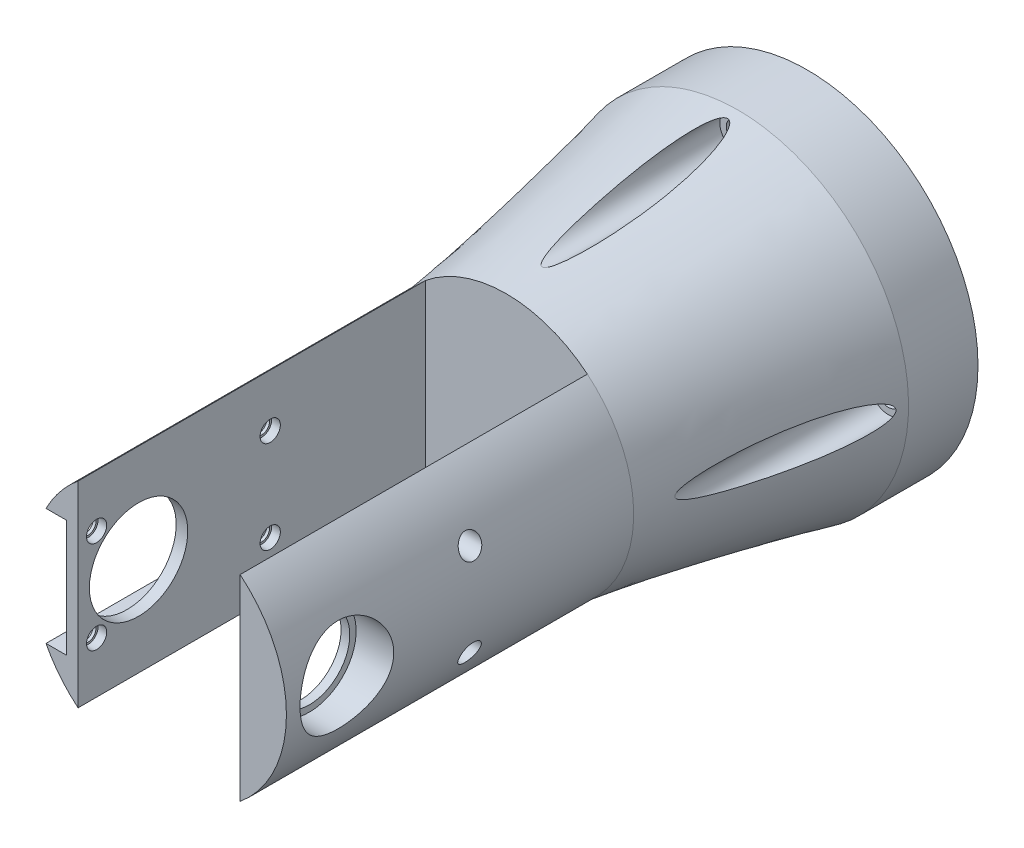
from build123d import *

# Parameters (mm, degrees)
SKETCH1_R           = 29.5
BOSS_EXTRUDE1_DEPTH = 12
SKETCH2_R           = 22
BOSS_EXTRUDE2_DEPTH = 100
SKETCH3_W           = 28
SKETCH3_H           = 50
CUT_EXTRUDE1_DEPTH  = 60
SKETCH11_R          = 2
CUT_EXTRUDE3_DEPTH  = 120.517781247
SKETCH12_R          = 3.1
CUT_EXTRUDE4_DEPTH  = 40
CUT_EXTRUDE7_START  = -35
CUT_EXTRUDE7_DEPTH  = 35
SKETCH14_R          = 8.5
CUT_EXTRUDE8_DEPTH  = 10
SKETCH15_R          = 1.4
CUT_EXTRUDE9_DEPTH  = 10
SKETCH16_R          = 8.1
CUT_EXTRUDE10_DEPTH = 10
SKETCH18_R          = 8.1
SKETCH18_R_2        = 7
BOSS_EXTRUDE3_DEPTH = 1.5
SKETCH19_R          = 1.75
CUT_EXTRUDE11_DEPTH = 1.5
SKETCH21_R          = 1.9
CUT_EXTRUDE13_DEPTH = 124.719440821


with BuildPart() as part:
    # Sketch1 → Boss-Extrude1 (new body)
    with BuildSketch(Plane.XY):
        Circle(SKETCH1_R)
    extrude(amount=BOSS_EXTRUDE1_DEPTH)

    # Sketch2 → Boss-Extrude2 (add)
    with BuildSketch(Plane.XY.offset(12)):
        Circle(SKETCH2_R)
    extrude(amount=BOSS_EXTRUDE2_DEPTH)

    # Sketch3 → Cut-Extrude1 (cut)
    with BuildSketch(Plane.XY.offset(112)):
        Rectangle(SKETCH3_W, SKETCH3_H)
    extrude(amount=-CUT_EXTRUDE1_DEPTH, mode=Mode.SUBTRACT)

    # Loft2: read off the stored shape, not the designer's step
    # Loft2: loft between two sections, ruled curve by curve
    loft2_from = [
        Edge.make_bspline([(6.119405658, -28.858324178, 12), (63.836054015, -16.619512862, 12), (51.597242698, 41.097135495, 12), (-6.119405658, 28.858324178, 12), (-63.836054015, 16.619512862, 12), (-51.597242698, -41.097135495, 12), (6.119405658, -28.858324178, 12)], [0, 0, 0, 0, 0.5, 0.5, 0.5, 1, 1, 1, 1], 3, [1, 0.333333333, 0.333333333, 1, 0.333333333, 0.333333333, 1]),
    ]
    loft2_to = [
        Edge.make_bspline([(-3.755202879, -21.677141217, 52), (39.599079554, -29.187546975, 52), (47.109485313, 14.166735458, 52), (3.755202879, 21.677141217, 52), (-39.599079554, 29.187546975, 52), (-47.109485313, -14.166735458, 52), (-3.755202879, -21.677141217, 52)], [0, 0, 0, 0, 0.5, 0.5, 0.5, 1, 1, 1, 1], 3, [1, 0.333333333, 0.333333333, 1, 0.333333333, 0.333333333, 1]),
    ]
    loft2 = Solid(Shell([*[Face.make_surface_from_curves(loft2_from[k], loft2_to[k]) for k in range(1)], Face(Wire(loft2_from)), Face(Wire(loft2_to))]))
    add(loft2)

    # Sketch11 → Cut-Extrude3 (cut, through all)
    with BuildSketch(Plane(origin=(0, 0, 0), x_dir=(-1, 0, 0), z_dir=(0, 0, -1))):
        with Locations((0, -26)):
            Circle(SKETCH11_R)
        with Locations((-26, 0)):
            Circle(SKETCH11_R)
        with Locations((0, 26)):
            Circle(SKETCH11_R)
        with Locations((26, 0)):
            Circle(SKETCH11_R)
    extrude(amount=-CUT_EXTRUDE3_DEPTH, mode=Mode.SUBTRACT)

    # Sketch12 → Cut-Extrude4 (cut)
    with BuildSketch(Plane.XY.offset(52)):
        with Locations((0, 26)):
            Circle(SKETCH12_R)
        with Locations((26, 0)):
            Circle(SKETCH12_R)
        with Locations((0, -26)):
            Circle(SKETCH12_R)
        with Locations((-26, 0)):
            Circle(SKETCH12_R)
    extrude(amount=-CUT_EXTRUDE4_DEPTH, mode=Mode.SUBTRACT)

    # Sketch13 → Cut-Extrude7 (cut)
    with BuildSketch(Plane.XY.offset(112).offset(CUT_EXTRUDE7_START)):
        with BuildLine():
            ThreePointArc((-19.544564462, -10.1), (-22, 0), (-19.544564462, 10.1))
            Line((-19.544564462, 10.1), (-16, 10.1))
            Line((-16, 10.1), (-16, -10.1))
            Line((-16, -10.1), (-19.544564462, -10.1))
        make_face()
    extrude(amount=CUT_EXTRUDE7_DEPTH, mode=Mode.SUBTRACT)

    # Sketch14 → Cut-Extrude8 (cut)
    with BuildSketch(Plane.ZY.offset(16)):
        with Locations((101.55, 0)):
            Circle(SKETCH14_R)
    extrude(amount=-CUT_EXTRUDE8_DEPTH, mode=Mode.SUBTRACT)

    # Sketch15 → Cut-Extrude9 (cut)
    with BuildSketch(Plane.ZY.offset(16)):
        with Locations((78.8, -8.1)):
            Circle(SKETCH15_R)
        with Locations((108.8, -8.1)):
            Circle(SKETCH15_R)
        with Locations((108.8, 7.9)):
            Circle(SKETCH15_R)
        with Locations((78.8, 7.9)):
            Circle(SKETCH15_R)
    extrude(amount=-CUT_EXTRUDE9_DEPTH, mode=Mode.SUBTRACT)

    # Sketch16 → Cut-Extrude10 (cut)
    with BuildSketch(Plane.ZY.offset(-14)):
        with Locations((101.55, -2.37e-07)):
            Circle(SKETCH16_R)
    extrude(amount=-CUT_EXTRUDE10_DEPTH, mode=Mode.SUBTRACT)

    # Sketch18 → Boss-Extrude3 (add)
    with BuildSketch(Plane.ZY.offset(-14)):
        with Locations((101.55, -2.37e-07)):
            Circle(SKETCH18_R)
        with Locations((101.55, -2.37e-07)):
            Circle(SKETCH18_R_2, mode=Mode.SUBTRACT)
    extrude(amount=-BOSS_EXTRUDE3_DEPTH)

    # Sketch19 → Cut-Extrude11 (cut)
    with BuildSketch(Plane(origin=(-14, 0, 0), x_dir=(0, 0, -1), z_dir=(1, 0, 0))):
        with Locations((-108.8, -8.1)):
            Circle(SKETCH19_R)
        with Locations((-78.8, -8.1)):
            Circle(SKETCH19_R)
        with Locations((-78.8, 7.9)):
            Circle(SKETCH19_R)
        with Locations((-108.8, 7.9)):
            Circle(SKETCH19_R)
    extrude(amount=-CUT_EXTRUDE11_DEPTH, mode=Mode.SUBTRACT)

    # Sketch21 → Cut-Extrude13 (cut, through all)
    with BuildSketch(Plane(origin=(-14, 0, 0), x_dir=(0, 0, -1), z_dir=(1, 0, 0))):
        with Locations(Location((-78.8, -8.1, 0), (0, 0, 180))):
            Circle(SKETCH21_R)
        with Locations(Location((-78.8, 7.9, 0), (0, 0, 180))):
            Circle(SKETCH21_R)
    extrude(amount=CUT_EXTRUDE13_DEPTH, mode=Mode.SUBTRACT)


solid = part.part
